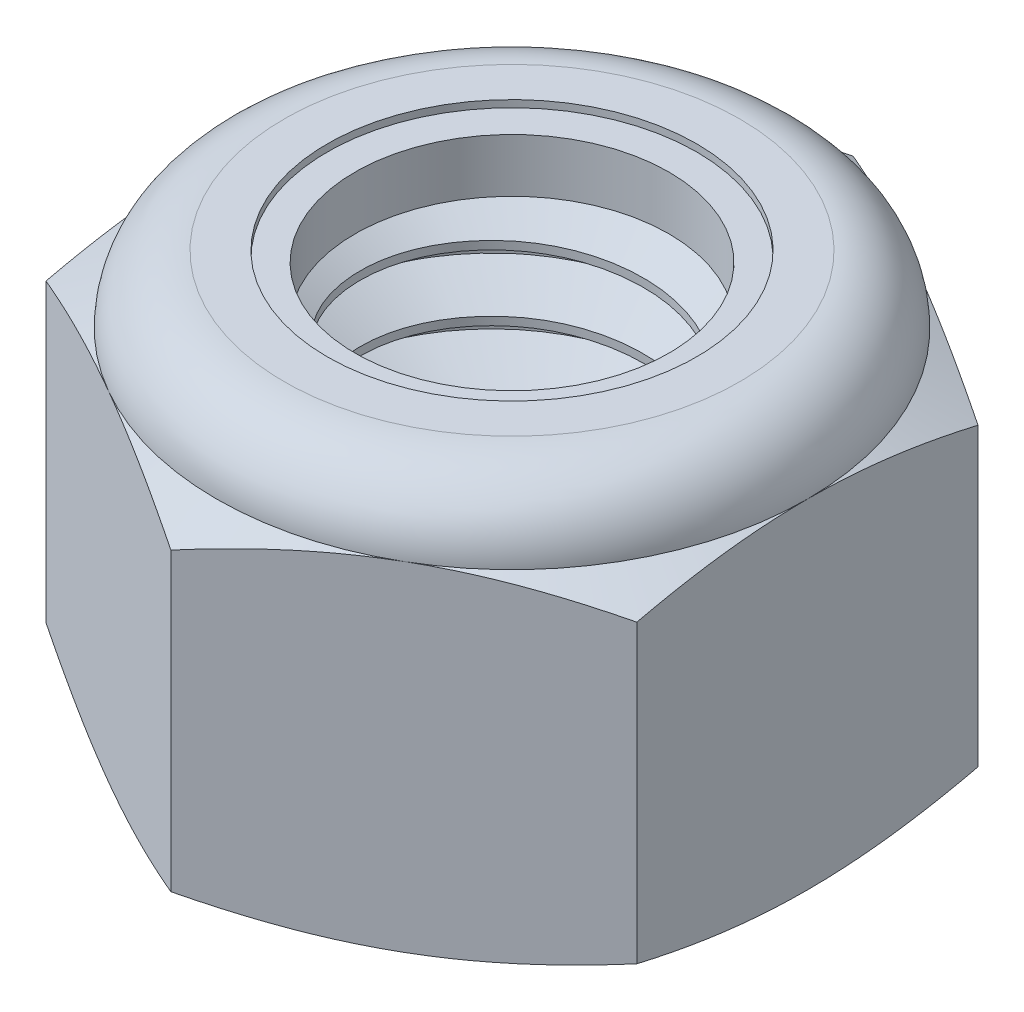
from build123d import *

# Parameters (mm, degrees)
SKETCH1_R        = 3.96875
EXTRUDE1_DEPTH   = 8.73125
SKETCH2_W        = 3.96875
SKETCH2_H        = 7.276041667
CUT_SWEEP1_PITCH = 1.411111111
SKETCH12_W       = 4.365625
SKETCH12_H       = 7.276041667


with BuildPart() as part:
    # Sketch1 → Extrude1 (new body)
    with BuildSketch(Plane(origin=(0, 0, 0), x_dir=(1, 0, 0), z_dir=(0, 1, 0))):
        Polygon((0, 7.332348419), (-6.35, 3.666174209), (-6.35, -3.666174209), (0, -7.332348419), (6.35, -3.666174209), (6.35, 3.666174209), align=None)
        with Locations(Location((0, 0, 0), (0, 0, 270))):
            Circle(SKETCH1_R, mode=Mode.SUBTRACT)
    extrude(amount=EXTRUDE1_DEPTH)

    # Sketch5 → Cut-Revolve3 (revolve, cut)
    with BuildSketch(Plane(origin=(0, 0, 0), x_dir=(0, 0, -1), z_dir=(1, 0, 0))):
        with BuildLine():
            Line((0, 0), (6.35, 0))
            Line((6.35, 0), (7.332348419, 0.458076591))
            Line((7.332348419, 0.458076591), (7.332348419, 6.817965076))
            Line((7.332348419, 6.817965076), (6.35, 7.276041667))
            ThreePointArc((6.35, 7.276041667), (5.923779347, 8.305029347), (4.894791667, 8.73125))
            Line((4.894791667, 8.73125), (4.894791667, 10.00125))
            Line((4.894791667, 10.00125), (8.602348419, 10.00125))
            Line((8.602348419, 10.00125), (8.602348419, -1.27))
            Line((8.602348419, -1.27), (0, -1.27))
            Line((0, -1.27), (0, 0))
        make_face()
    revolve(axis=Axis((0, 0, 0), (0, 1, 0)), mode=Mode.SUBTRACT)

    # Sketch6 → Cut-Revolve4 (revolve, cut)
    with BuildSketch(Plane(origin=(0, 0, 0), x_dir=(0, 0, -1), z_dir=(1, 0, 0)), mode=Mode.PRIVATE) as cut_revolve4_sk:
        with BuildLine():
            Line((0, 7.276041667), (6.1976, 7.276041667))
            ThreePointArc((6.1976, 7.276041667), (5.816016274, 8.197266274), (4.894791667, 8.57885))
            Line((4.894791667, 8.57885), (2.447395833, 8.57885))
            Line((2.447395833, 8.57885), (2.447395833, 10.00125))
            Line((2.447395833, 10.00125), (0, 10.00125))
            Line((0, 10.00125), (0, 7.276041667))
        make_face()
    revolve(cut_revolve4_sk.sketch.rotate(Axis((0, 10.00125, 0), (0, -1, 0)), 180), axis=Axis((0, 10.00125, 0), (0, -1, 0)), mode=Mode.SUBTRACT)

    # Sketch4 → Cut-Revolve2 (revolve, cut)
    with BuildSketch(Plane(origin=(0, 0, 0), x_dir=(0, 0, -1), z_dir=(1, 0, 0))):
        Polygon((0, 7.276041667), (4.365625, 7.276041667), (0, 5.240317297), align=None)
        Polygon((0, 2.03572437), (4.365625, 0), (0, 0), align=None)
    revolve(axis=Axis((0, 0, 0), (0, 1, 0)), mode=Mode.SUBTRACT)

    # Sketch12 → Revolve4 (revolve)
    with BuildSketch(Plane(origin=(0, 0, 0), x_dir=(0, 0, -1), z_dir=(1, 0, 0)), mode=Mode.PRIVATE) as revolve4_sk:
        with Locations((2.1828125, 3.638020834)):
            Rectangle(SKETCH12_W, SKETCH12_H)
    revolve(revolve4_sk.sketch.rotate(Axis((0, 0, 0), (0, 1, 0)), 350.737723233), axis=Axis((0, 0, 0), (0, 1, 0)))


with BuildPart() as body_2:
    # Sketch7 → Revolve2 (revolve)
    with BuildSketch(Plane(origin=(0, 0, 0), x_dir=(0, 0, -1), z_dir=(1, 0, 0))):
        with BuildLine():
            Line((3.3734375, 7.352241667), (6.119030844, 7.352241667))
            ThreePointArc((6.119030844, 7.352241667), (5.734762038, 8.169919611), (4.894791667, 8.50265))
            Line((4.894791667, 8.50265), (3.3734375, 8.50265))
            Line((3.3734375, 8.50265), (3.3734375, 7.352241667))
        make_face()
    revolve(axis=Axis((0, 7.352241667, 0), (0, 1, 0)))


with BuildPart() as body_3:
    # Sketch2 → Revolve1 (revolve)
    with BuildSketch(Plane(origin=(0, 0, 0), x_dir=(0, 0, -1), z_dir=(1, 0, 0))):
        with Locations((1.984375, 3.638020834)):
            Rectangle(SKETCH2_W, SKETCH2_H)
    revolve(axis=Axis((0, -3.96875, 0), (0, 1, 0)))

    # Cut-Sweep1: the profile of Sketch9 screwed along a right-hand helix of 7.1875 turns, 8 arcs to a turn; built about Z, then put on its axis
    cut_sweep1_z = Axis((0, 0, 0), (0, 0, 1))
    cut_sweep1_corners = [(4.121507259, 0, 0.088194444), (4.045128629, 0, -1.278819444), (3.052206448, 0, -0.705555556), (3.052206448, 0, -0.529166667)]
    with BuildLine(mode=Mode.PRIVATE) as cut_sweep1_profile:
        Line(cut_sweep1_corners[0], cut_sweep1_corners[1])
        Line(cut_sweep1_corners[1], cut_sweep1_corners[2])
        Line(cut_sweep1_corners[2], cut_sweep1_corners[3])
        Line(cut_sweep1_corners[3], cut_sweep1_corners[0])
    cut_sweep1_cap = Face(cut_sweep1_profile.wire())
    cut_sweep1_turn_angles = [0, 22.5, 45, 67.5, 90, 112.5, 135, 157.5, 180, 202.5, 225, 247.5, 270, 292.5, 315, 337.5, 360]
    cut_sweep1_turn_weights = [1, 0.9238795325112867, 1, 0.9238795325112867, 1, 0.9238795325112867, 1, 0.9238795325112867, 1, 0.9238795325112867, 1, 0.9238795325112867, 1, 0.9238795325112867, 1, 0.9238795325112867, 1]
    cut_sweep1_turn_rails = [Edge.make_bspline([Vector(p[0], p[1], 0).rotate(cut_sweep1_z, cut_sweep1_turn_angles[k]) / cut_sweep1_turn_weights[k] + Vector(0, 0, p[2] + CUT_SWEEP1_PITCH * cut_sweep1_turn_angles[k] / 360) for k in range(17)], [0, 0, 0, 1, 1, 2, 2, 3, 3, 4, 4, 5, 5, 6, 6, 7, 7, 8, 8, 8], 2, cut_sweep1_turn_weights) for p in cut_sweep1_corners]
    cut_sweep1_turn_sides = [Face.make_surface_from_curves(cut_sweep1_turn_rails[p[0]], cut_sweep1_turn_rails[p[1]]) for p in [(0, 1), (1, 2), (2, 3), (3, 0)]]
    cut_sweep1_last_angles = [2520, 2542.5, 2565, 2576.25, 2587.5]
    cut_sweep1_last_weights = [1, 0.9238795325112867, 1, 0.9807852804032483, 1]
    cut_sweep1_last_rails = [Edge.make_bspline([Vector(p[0], p[1], 0).rotate(cut_sweep1_z, cut_sweep1_last_angles[k]) / cut_sweep1_last_weights[k] + Vector(0, 0, p[2] + CUT_SWEEP1_PITCH * cut_sweep1_last_angles[k] / 360) for k in range(5)], [0, 0, 0, 1, 1, 2, 2, 2], 2, cut_sweep1_last_weights) for p in cut_sweep1_corners]
    cut_sweep1_last_sides = [Face.make_surface_from_curves(cut_sweep1_last_rails[p[0]], cut_sweep1_last_rails[p[1]]) for p in [(0, 1), (1, 2), (2, 3), (3, 0)]]
    cut_sweep1 = Plane(origin=(0, 7.276041667, 0), x_dir=(0, 0, -1), z_dir=(0, -1, 0)) * Solid(Shell([*[p.moved(Location((0, 0, CUT_SWEEP1_PITCH * i))) for i in range(7) for p in cut_sweep1_turn_sides], *cut_sweep1_last_sides, cut_sweep1_cap, cut_sweep1_cap.rotate(cut_sweep1_z, 2587.5).moved(Location((0, 0, CUT_SWEEP1_PITCH * 2587.5 / 360)))]))
    add(cut_sweep1, mode=Mode.SUBTRACT)

    # Sketch11 → Revolve3 (revolve)
    with BuildSketch(Plane(origin=(0, 0, 0), x_dir=(0, 0, -1), z_dir=(1, 0, 0))):
        Polygon((0, 0), (4.365625, 0), (0, 2.03572437), align=None)
    revolve(axis=Axis((0, 8.73125, 0), (0, -1, 0)))


with BuildPart() as part_1:
    add(part.part)

    # Combine1: cut body 3
    add(body_3.part, mode=Mode.SUBTRACT)


solid = Compound([body_2.part, part_1.part])
